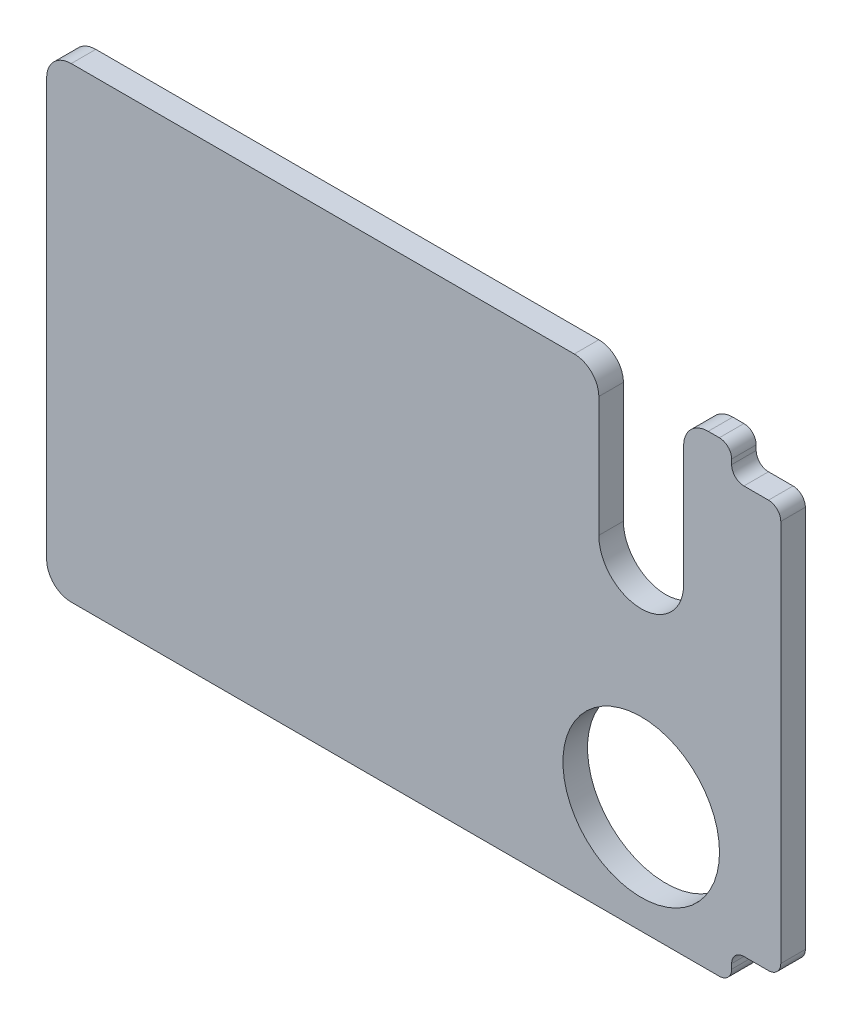
from build123d import *
from OCP.BRepFilletAPI import BRepFilletAPI_MakeFillet

# Parameters (mm, degrees)
SKETCH1_R           = 20.2311
BOSS_EXTRUDE1_DEPTH = 6.35
FILLET1_R1          = 6.35
FILLET1_R2          = 3.175


with BuildPart() as part:
    # Sketch1 → Boss-Extrude1 (new body)
    with BuildSketch(Plane.XY):
        with BuildLine():
            Line((-114.3, 72.540551407), (28.4099, 72.540551407))
            Line((28.4099, 72.540551407), (28.4099, 35.1155))
            ThreePointArc((28.4099, 35.1155), (39.37, 24.1554), (50.3301, 35.1155))
            Line((50.3301, 35.1155), (50.3301, 72.540551407))
            Line((50.3301, 72.540551407), (62.738, 72.540551407))
            Line((62.738, 72.540551407), (62.738, 64.920551407))
            Line((62.738, 64.920551407), (75.438, 64.920551407))
            Line((75.438, 64.920551407), (75.438, -40.3939375))
            Line((75.438, -40.3939375), (62.738, -40.3939375))
            Line((62.738, -40.3939375), (62.738, -48.0139375))
            Line((62.738, -48.0139375), (-114.3, -48.0139375))
            Line((-114.3, -48.0139375), (-114.3, 72.540551407))
        make_face()
        with Locations((39.37, -20.2311)):
            Circle(SKETCH1_R, mode=Mode.SUBTRACT)
    extrude(amount=BOSS_EXTRUDE1_DEPTH)

    # Fillet1: one fillet with a radius per group of edges: ONE call of the kernel's fillet builder (fillet() takes one radius for all edges)
    fillet1_edges_1 = [part.edges().sort_by_distance(p)[0] for p in [
        (50.3301, 72.540551407, 3.175),
        (28.4099, 72.540551407, 3.175),
        (-114.3, 72.540551407, 3.175),
        (-114.3, -48.0139375, 3.175),
    ]]
    fillet1_edges_2 = [part.edges().sort_by_distance(p)[0] for p in [
        (62.738, 64.920551407, 3.175),
        (75.438, 64.920551407, 3.175),
        (62.738, 72.540551407, 3.175),
        (62.738, -48.0139375, 3.175),
        (62.738, -40.3939375, 3.175),
        (75.438, -40.3939375, 3.175),
    ]]
    fillet1 = BRepFilletAPI_MakeFillet(part.part.solid().wrapped)
    for e in fillet1_edges_1:
        fillet1.Add(FILLET1_R1, e.wrapped)
    for e in fillet1_edges_2:
        fillet1.Add(FILLET1_R2, e.wrapped)
    add(Compound.cast(fillet1.Shape()), mode=Mode.REPLACE)


solid = part.part
